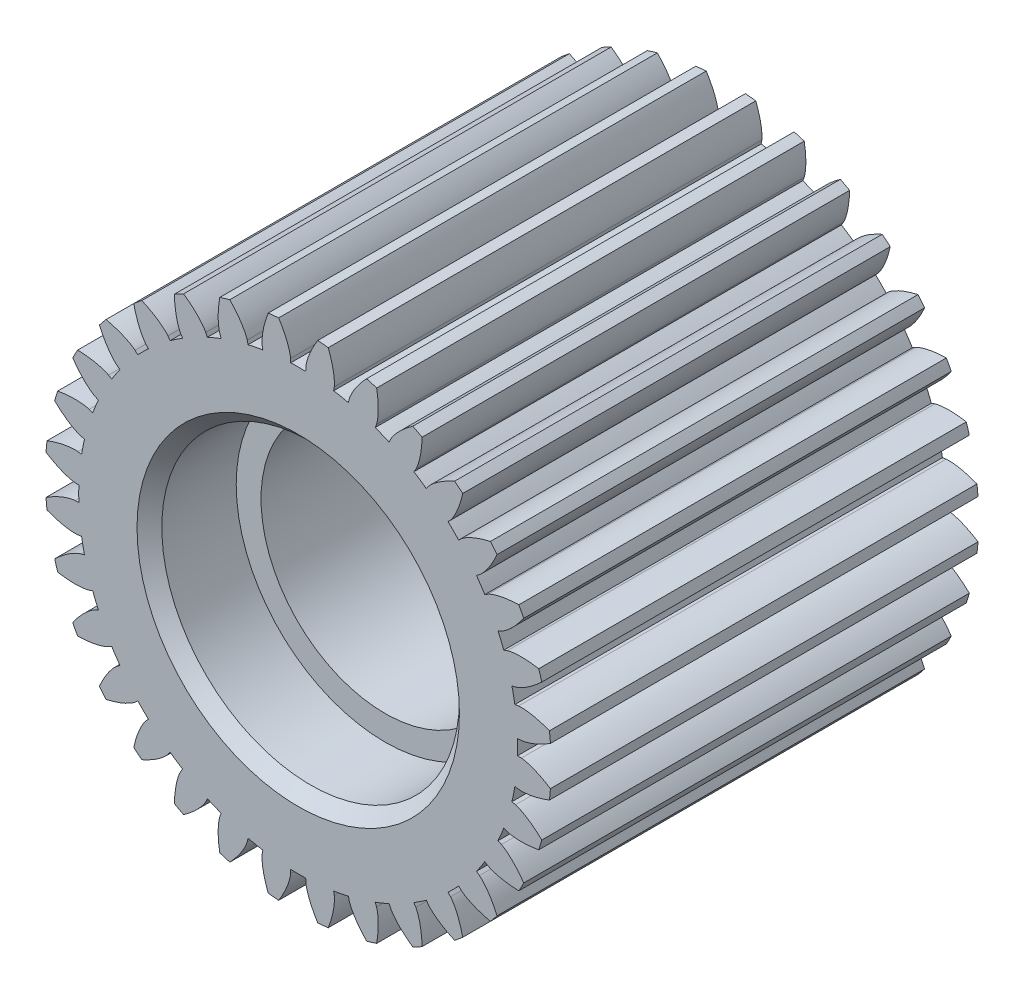
from build123d import *

# Parameters (mm, degrees)
SKETCH1_R           = 15
BOSS_EXTRUDE1_DEPTH = 8.6194635
CUT_EXTRUDE1_DEPTH  = 23.897492243
CIRPATTERN2_COUNT   = 48
SKETCH4_R           = 10.2
BOSS_EXTRUDE2_DEPTH = 17.238927
CUT_EXTRUDE2_START  = -17.238927
CUT_EXTRUDE2_DEPTH  = 17.238927
CIRPATTERN3_COUNT   = 32
SKETCH3_R           = 5
CUT_EXTRUDE3_DEPTH  = 41.467254904
SKETCH7_R           = 6
CUT_EXTRUDE4_DEPTH  = 3.5
SKETCH8_R           = 16.259495025
CUT_EXTRUDE5_DEPTH  = 17.238927
CHAMFER1_SIZE       = 0.5


with BuildPart() as part:
    # Sketch1 → Boss-Extrude1 (new, symmetric)
    with BuildSketch(Plane.XY):
        Circle(SKETCH1_R)
    extrude(amount=BOSS_EXTRUDE1_DEPTH, both=True)

    # Sketch2 → Cut-Extrude1 (cut, symmetric)
    with BuildSketch(Plane.XY):
        with BuildLine():
            ThreePointArc((13.65, 0), (13.649458147, -0.121623574), (13.647832631, -0.243237491))
            ThreePointArc((13.647832631, -0.243237491), (13.647735116, -0.248648742), (13.647635456, -0.254059954))
            add(Edge.make_bspline(
                [(13.647635456, -0.254059954), (13.657268379, -0.255534435), (13.68238973, -0.259564128), (13.730527047, -0.268126875), (13.801467646, -0.282849021), (13.885336497, -0.302927931), (13.976159587, -0.32757172), (14.066355852, -0.354624836), (14.155909825, -0.383899457), (14.24471583, -0.415119877), (14.351771679, -0.455359025), (14.479398257, -0.506969544), (14.627387076, -0.572156088), (14.777803486, -0.644167477), (14.888016201, -0.700877716), (14.955413547, -0.736860176), (14.981197136, -0.750821123)],
                knots=[0.035283251, 0.035283251, 0.035283251, 0.035283251, 0.035283251, 0.04661014, 0.064854849, 0.092110525, 0.119476176, 0.146842496, 0.174208854, 0.201574956, 0.228941013, 0.256307345, 0.307035032, 0.361767352, 0.416499661, 0.450632045, 0.450632045, 0.450632045, 0.450632045, 0.450632045], degree=4))
            ThreePointArc((14.981197136, -0.750821123), (14.995298547, -0.375528263), (15, 0))
            ThreePointArc((15, 0), (14.995314217, 0.374902027), (14.981259796, 0.749569826))
            add(Edge.make_bspline(
                [(13.647641585, 0.253730505), (13.657888966, 0.255284626), (13.683625528, 0.25939114), (13.732375995, 0.268044744), (13.803923243, 0.282892786), (13.887792095, 0.302971696), (13.978615184, 0.327615485), (14.06881145, 0.3546686), (14.158365422, 0.383943221), (14.247171427, 0.415163642), (14.354227276, 0.45540279), (14.481853854, 0.507013309), (14.629842673, 0.572199853), (14.779646167, 0.64391781), (14.889256283, 0.700296155), (14.956067309, 0.735942281), (14.981259796, 0.749569826)],
                knots=[0.034563274, 0.034563274, 0.034563274, 0.034563274, 0.034563274, 0.04661014, 0.064854849, 0.092110525, 0.119476176, 0.146842496, 0.174208854, 0.201574956, 0.228941013, 0.256307345, 0.307035032, 0.361767352, 0.416499661, 0.449840211, 0.449840211, 0.449840211, 0.449840211, 0.449840211], degree=4))
            ThreePointArc((13.647641585, 0.253730505), (13.647738116, 0.248484017), (13.647832631, 0.243237491))
            ThreePointArc((13.647832631, 0.243237491), (13.649458147, 0.121623574), (13.65, 0))
        make_face()
    cut_extrude1 = extrude(amount=CUT_EXTRUDE1_DEPTH, both=True, mode=Mode.SUBTRACT)

    # CirPattern2: Cut-Extrude1 ×48 about axis
    cirpattern2_axis = Axis((0, 0, 8.6194635), (0, 0, -1))
    for i in range(1, CIRPATTERN2_COUNT):
        add(cut_extrude1.rotate(cirpattern2_axis, i * 360 / CIRPATTERN2_COUNT), mode=Mode.SUBTRACT)

    # Sketch4 → Boss-Extrude2 (add)
    with BuildSketch(Plane(origin=(0, 0, -8.6194635), x_dir=(-1, 0, 0), z_dir=(0, 0, -1))):
        with Locations(Location((0, 0, 0), (0, 0, 180))):
            Circle(SKETCH4_R)
    extrude(amount=BOSS_EXTRUDE2_DEPTH)

    # Sketch5 → Cut-Extrude2 (cut)
    with BuildSketch(Plane(origin=(0, 0, -25.8583905), x_dir=(-1, 0, 0), z_dir=(0, 0, -1)).offset(CUT_EXTRUDE2_START)):
        with BuildLine():
            add(Edge.make_bspline(
                [(8.995207934, 0.307603024), (8.998288496, 0.307752761), (9.006921842, 0.308309977), (9.023213434, 0.309905236), (9.049735741, 0.31327654), (9.098862504, 0.321184887), (9.157507151, 0.333386782), (9.223356846, 0.349830203), (9.293684455, 0.370153857), (9.353512158, 0.389170698), (9.412887493, 0.409661338), (9.471743024, 0.431440846), (9.542665115, 0.4594311), (9.627175152, 0.495225634), (9.725110115, 0.540291749), (9.835134308, 0.595196046), (9.946051945, 0.65516941), (10.042739339, 0.710888137), (10.112313714, 0.753458331), (10.15416465, 0.779782211), (10.169402243, 0.789466921)],
                knots=[0, 0, 0, 0, 0, 0.005376749, 0.015083688, 0.02853182, 0.04661014, 0.092110525, 0.119476176, 0.146842496, 0.174208854, 0.201574956, 0.228941013, 0.256307345, 0.307035032, 0.361767352, 0.416499661, 0.471231937, 0.525964282, 0.557559535, 0.557559535, 0.557559535, 0.557559535, 0.557559535], degree=4))
            Line((8.995207934, 0.307603024), (8.84482999, 0.302460651))
            ThreePointArc((8.84482999, 0.302460651), (8.848707403, 0.151252417), (8.85, 0))
            ThreePointArc((8.85, 0), (8.848707403, -0.151252417), (8.84482999, -0.302460651))
            Line((8.84482999, -0.302460651), (8.995207934, -0.307603024))
            add(Edge.make_bspline(
                [(8.995207934, -0.307603024), (8.998288496, -0.307752761), (9.006921842, -0.308309977), (9.023213434, -0.309905236), (9.049735741, -0.31327654), (9.098862504, -0.321184887), (9.157507151, -0.333386782), (9.223356846, -0.349830203), (9.293684455, -0.370153857), (9.353512158, -0.389170698), (9.412887493, -0.409661338), (9.471743024, -0.431440846), (9.542665115, -0.4594311), (9.627175152, -0.495225634), (9.725110115, -0.540291749), (9.835134308, -0.595196046), (9.946051945, -0.65516941), (10.042739339, -0.710888137), (10.112313714, -0.753458331), (10.15416465, -0.779782211), (10.169402243, -0.789466921)],
                knots=[0, 0, 0, 0, 0, 0.005376749, 0.015083688, 0.02853182, 0.04661014, 0.092110525, 0.119476176, 0.146842496, 0.174208854, 0.201574956, 0.228941013, 0.256307345, 0.307035032, 0.361767352, 0.416499661, 0.471231937, 0.525964282, 0.557559535, 0.557559535, 0.557559535, 0.557559535, 0.557559535], degree=4))
            ThreePointArc((10.169402243, -0.789466921), (10.19234769, -0.395029822), (10.2, 0))
            ThreePointArc((10.2, 0), (10.19234769, 0.395029822), (10.169402243, 0.789466921))
        make_face()
    cut_extrude2 = extrude(amount=CUT_EXTRUDE2_DEPTH, mode=Mode.SUBTRACT)

    # CirPattern3: Cut-Extrude2 ×32 about axis
    cirpattern3_axis = Axis((0, 0, -25.8583905), (0, 0, 1))
    for i in range(1, CIRPATTERN3_COUNT):
        add(cut_extrude2.rotate(cirpattern3_axis, i * 360 / CIRPATTERN3_COUNT), mode=Mode.SUBTRACT)

    # Sketch3 → Cut-Extrude3 (cut, through all)
    with BuildSketch(Plane.XY.offset(8.6194635)):
        Circle(SKETCH3_R)
    extrude(amount=-CUT_EXTRUDE3_DEPTH, mode=Mode.SUBTRACT)

    # Sketch7 → Cut-Extrude4 (cut)
    with BuildSketch(Plane(origin=(0, 0, -25.8583905), x_dir=(-1, 0, 0), z_dir=(0, 0, -1))):
        Circle(SKETCH7_R)
    cut_extrude4 = extrude(amount=-CUT_EXTRUDE4_DEPTH, mode=Mode.SUBTRACT)

    # Sketch8 → Cut-Extrude5 (cut)
    with BuildSketch(Plane.XY.offset(8.6194635)):
        Circle(SKETCH8_R)
    extrude(amount=-CUT_EXTRUDE5_DEPTH, mode=Mode.SUBTRACT)

    # Mirror3: Cut-Extrude4 across plane
    add(cut_extrude4.mirror(Plane(origin=(0, 0, -17.238927), x_dir=(1, 0, 0), z_dir=(0, 0, -1))), mode=Mode.SUBTRACT)

    # Chamfer1
    chamfer1_edges = [part.edges().sort_by_distance(p)[0] for p in [
        (6, 0, -25.8583905),
        (6, 0, -8.6194635),
    ]]
    chamfer(chamfer1_edges, length=CHAMFER1_SIZE)


solid = part.part
